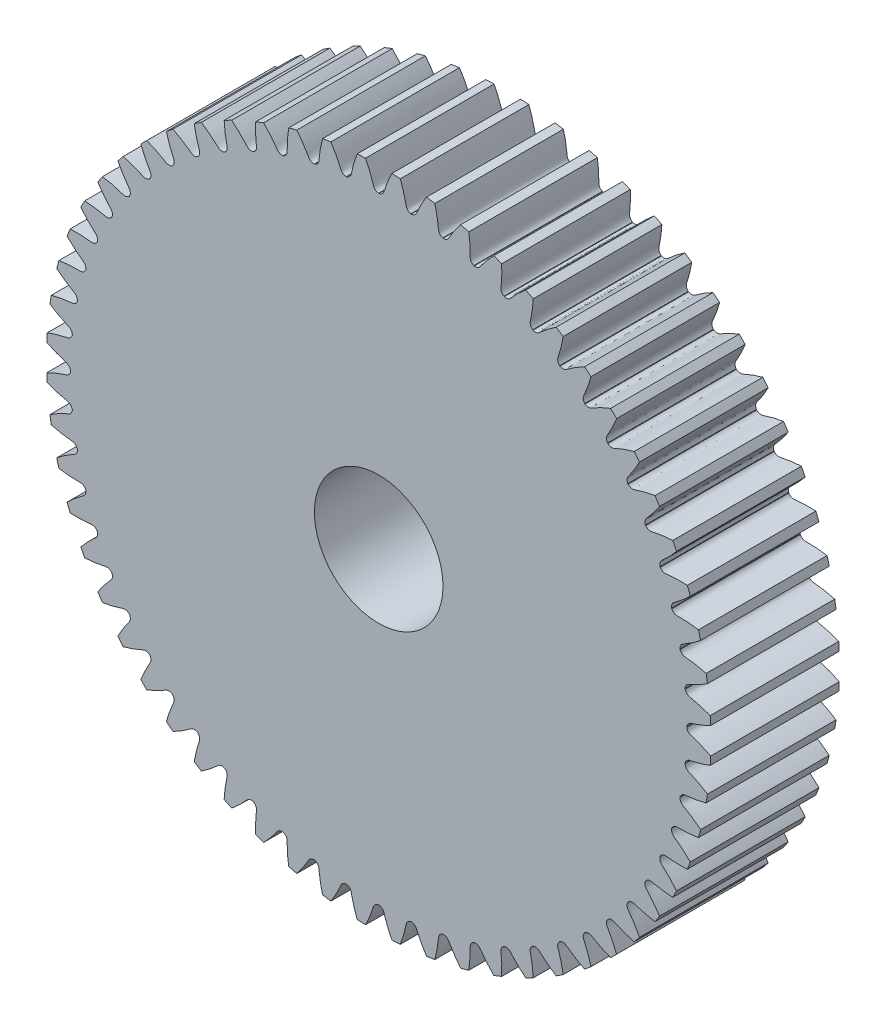
from build123d import *

# Parameters (mm, degrees)
SKETCH_1_R               = 15.5
EXTRUDE_1_DEPTH          = 6
CUT_EXTRUDE_1_DEPTH      = 23.726636355
PATTERN_CIRCULAR_1_COUNT = 60
SKETCH_4_R               = 3
CUT_EXTRUDE_2_DEPTH      = 10


with BuildPart() as part:
    # 草图1 → 凸台-拉伸1 (new body)
    with BuildSketch(Plane.XY):
        Circle(SKETCH_1_R)
    extrude(amount=EXTRUDE_1_DEPTH)

    # 草图2 → 切除-拉伸1 (cut, through all)
    with BuildSketch(Plane.XY):
        with BuildLine():
            ThreePointArc((0.01, 14.374977573), (0, 14.374981051), (-0.01, 14.374977573))
            add(Edge.make_bspline(
                [(-0.01, 14.374977573), (-0.215224906, 14.412153918), (-0.24829968, 14.583899443), (-0.31193537, 14.775117562), (-0.342016179, 14.861577537), (-0.375928996, 14.952617583), (-0.413683423, 15.048231169), (-0.455529174, 15.148265541), (-0.501641571, 15.252602946), (-0.552213108, 15.361107861), (-0.60742665, 15.473642434), (-0.667462987, 15.59006214), (-0.732498455, 15.710217155), (-0.80270543, 15.833952089), (-0.878251989, 15.961106202), (-0.959301823, 16.091513475), (-1.046014077, 16.225002736), (-1.138543214, 16.361397774), (-1.237038873, 16.500517457), (-1.341645741, 16.642175854), (-1.452503416, 16.786182365), (-1.569746291, 16.932341849), (-1.693503373, 17.080454756), (-1.8698308, 17.283107216), (-2.008572426, 17.433098444), (-2.10427602, 17.532609244)],
                knots=[0, 0, 0, 0, 0.111713127, 0.134138646, 0.158036498, 0.183406681, 0.210249195, 0.238564042, 0.26835122, 0.29961073, 0.332342571, 0.366546744, 0.402223249, 0.439372086, 0.477993254, 0.518086754, 0.559652586, 0.60269075, 0.647201245, 0.693184072, 0.740639231, 0.789566721, 0.839966543, 0.891838697, 1, 1, 1, 1], degree=3))
            ThreePointArc((-2.10427602, 17.532609244), (0, 17.658436071), (2.10427602, 17.532609244))
            add(Edge.make_bspline(
                [(0.01, 14.374977573), (0.215224906, 14.412153918), (0.24829968, 14.583899443), (0.31193537, 14.775117562), (0.342016179, 14.861577537), (0.375928996, 14.952617583), (0.413683423, 15.048231169), (0.455529174, 15.148265541), (0.501641571, 15.252602946), (0.552213108, 15.361107861), (0.60742665, 15.473642434), (0.667462987, 15.59006214), (0.732498455, 15.710217155), (0.80270543, 15.833952089), (0.878251989, 15.961106202), (0.959301823, 16.091513475), (1.046014077, 16.225002736), (1.138543214, 16.361397774), (1.237038873, 16.500517457), (1.341645741, 16.642175854), (1.452503416, 16.786182365), (1.569746291, 16.932341849), (1.693503373, 17.080454756), (1.8698308, 17.283107216), (2.008572426, 17.433098444), (2.10427602, 17.532609244)],
                knots=[0, 0, 0, 0, 0.111713127, 0.134138646, 0.158036498, 0.183406681, 0.210249195, 0.238564042, 0.26835122, 0.29961073, 0.332342571, 0.366546744, 0.402223249, 0.439372086, 0.477993254, 0.518086754, 0.559652586, 0.60269075, 0.647201245, 0.693184072, 0.740639231, 0.789566721, 0.839966543, 0.891838697, 1, 1, 1, 1], degree=3))
        make_face()
    cut_extrude_1 = extrude(amount=CUT_EXTRUDE_1_DEPTH, mode=Mode.SUBTRACT)

    # 阵列(圆周)1: 切除-拉伸1 ×60 about axis
    pattern_circular_1_axis = Axis((0, 0, -0.3), (0, 0, 1))
    for i in range(1, PATTERN_CIRCULAR_1_COUNT):
        add(cut_extrude_1.rotate(pattern_circular_1_axis, i * 360 / PATTERN_CIRCULAR_1_COUNT), mode=Mode.SUBTRACT)

    # 草图4 → 切除-拉伸2 (cut)
    with BuildSketch(Plane.XY.offset(6)):
        Circle(SKETCH_4_R)
    extrude(amount=-CUT_EXTRUDE_2_DEPTH, mode=Mode.SUBTRACT)


solid = part.part
